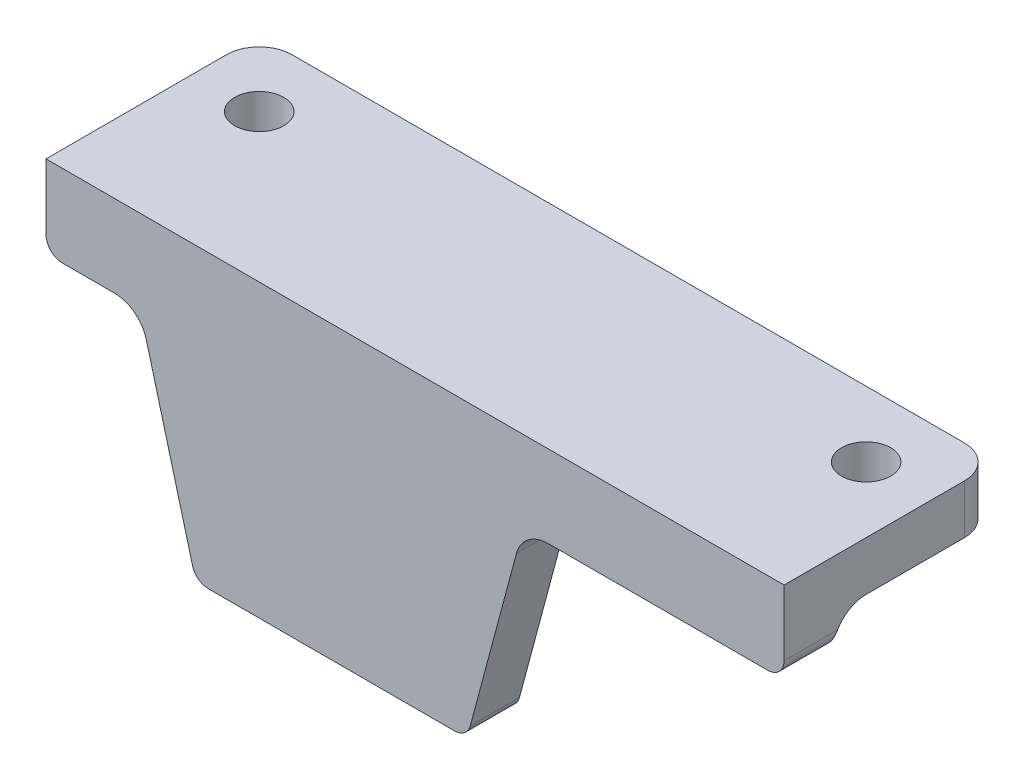
from build123d import *

# Parameters (mm, degrees)
BOSS_EXTRUDE1_DEPTH = 3
SKETCH4_W           = 45
SKETCH4_H           = 3
BOSS_EXTRUDE2_DEPTH = 10
FILLET1_R           = 2
FILLET2_R           = 2
SKETCH5_R           = 1.5
CUT_EXTRUDE1_DEPTH  = 29.702134145
SKETCH6_R           = 3.5
BOSS_EXTRUDE3_DEPTH = 16
FILLET3_R           = 0.5
SKETCH7_W           = 10
SKETCH7_H           = 8.75
BOSS_EXTRUDE4_DEPTH = 1.5
FILLET4_R           = 1


with BuildPart() as part:
    # Sketch3 → Boss-Extrude1 (new body)
    with BuildSketch(Plane.XY):
        with BuildLine():
            Line((2.4, -6), (-12.6, -6))
            ThreePointArc((-12.6, -6), (-13.208761429, -5.79335334), (-13.565925826, -5.258819045))
            Line((-13.565925826, -5.258819045), (-16.386481515, 5.26763809))
            ThreePointArc((-16.386481515, 5.26763809), (-17.100810309, 6.336706681), (-18.318333167, 6.75))
            Line((-18.318333167, 6.75), (-21.5, 6.75))
            ThreePointArc((-21.5, 6.75), (-22.207106781, 7.042893219), (-22.5, 7.75))
            Line((-22.5, 7.75), (-22.5, 11.75))
            Line((-22.5, 11.75), (22.5, 11.75))
            Line((22.5, 11.75), (22.5, 7.75))
            ThreePointArc((22.5, 7.75), (22.207106781, 7.042893219), (21.5, 6.75))
            Line((21.5, 6.75), (8.118333167, 6.75))
            ThreePointArc((8.118333167, 6.75), (6.900810309, 6.336706681), (6.186481515, 5.26763809))
            Line((6.186481515, 5.26763809), (3.365925826, -5.258819045))
            ThreePointArc((3.365925826, -5.258819045), (3.008761429, -5.79335334), (2.4, -6))
        make_face()
    extrude(amount=BOSS_EXTRUDE1_DEPTH)

    # Sketch4 → Boss-Extrude2 (add)
    with BuildSketch(Plane(origin=(0, 0, 0), x_dir=(-1, 0, 0), z_dir=(0, 0, -1))):
        with Locations((0, 10.25)):
            Rectangle(SKETCH4_W, SKETCH4_H)
    extrude(amount=BOSS_EXTRUDE2_DEPTH)

    # Fillet1
    fillet1_edges = [part.edges().sort_by_distance(p)[0] for p in [
        (0, 8.75, 0),
    ]]
    fillet(fillet1_edges, radius=FILLET1_R - 0.0001)  # a hair under: the kernel refuses the full size

    # Fillet2
    fillet2_edges = [part.edges().sort_by_distance(p)[0] for p in [
        (22.5, 10.25, -10),
        (-22.5, 10.25, -10),
    ]]
    fillet(fillet2_edges, radius=FILLET2_R)

    # Sketch5 → Cut-Extrude1 (cut, through all)
    with BuildSketch(Plane.XZ.offset(-8.75)):
        with Locations(Location((-18.5, -6, 0), (0, 0, 270))):
            Circle(SKETCH5_R)
    cut_extrude1 = extrude(amount=-CUT_EXTRUDE1_DEPTH, mode=Mode.SUBTRACT)

    # Mirror1: Cut-Extrude1 across plane
    add(cut_extrude1.mirror(Plane(origin=(0, 0, 0), x_dir=(0, 0, 1), z_dir=(1, 0, 0))), mode=Mode.SUBTRACT)

    # Sketch6 → Boss-Extrude3 (add)
    with BuildSketch(Plane(origin=(0, 0, 0), x_dir=(-1, 0, 0), z_dir=(0, 0, -1))):
        with Locations((5.1, 0)):
            Circle(SKETCH6_R)
    extrude(amount=BOSS_EXTRUDE3_DEPTH)

    # Fillet3
    fillet3_edges = [part.edges().sort_by_distance(p)[0] for p in [
        (-1.6, 0, -16),
    ]]
    fillet(fillet3_edges, radius=FILLET3_R)

    # Sketch7 → Boss-Extrude4 (add, symmetric)
    with BuildSketch(Plane(origin=(-5.1, 0, 0), x_dir=(0, 0, -1), z_dir=(1, 0, 0))):
        with Locations((5, 4.375)):
            Rectangle(SKETCH7_W, SKETCH7_H)
    extrude(amount=BOSS_EXTRUDE4_DEPTH, both=True)

    # Fillet4
    fillet4_edges = [part.edges().sort_by_distance(p)[0] for p in [
        (-3.6, 8.164242852, -0.585757148),
        (-6.6, 4.95618883, 0),
        (-6.6, 8.164242852, -0.585757148),
        (-6.6, 8.75, -5.99995),
        (-3.6, 8.75, -5.99995),
        (-3.6, 4.95618883, 0),
        (-6.6, 3.16227766, -5),
        (-5.1, 3.5, -10),
        (-3.6, 3.16227766, -5),
    ]]
    fillet(fillet4_edges, radius=FILLET4_R)


solid = part.part
